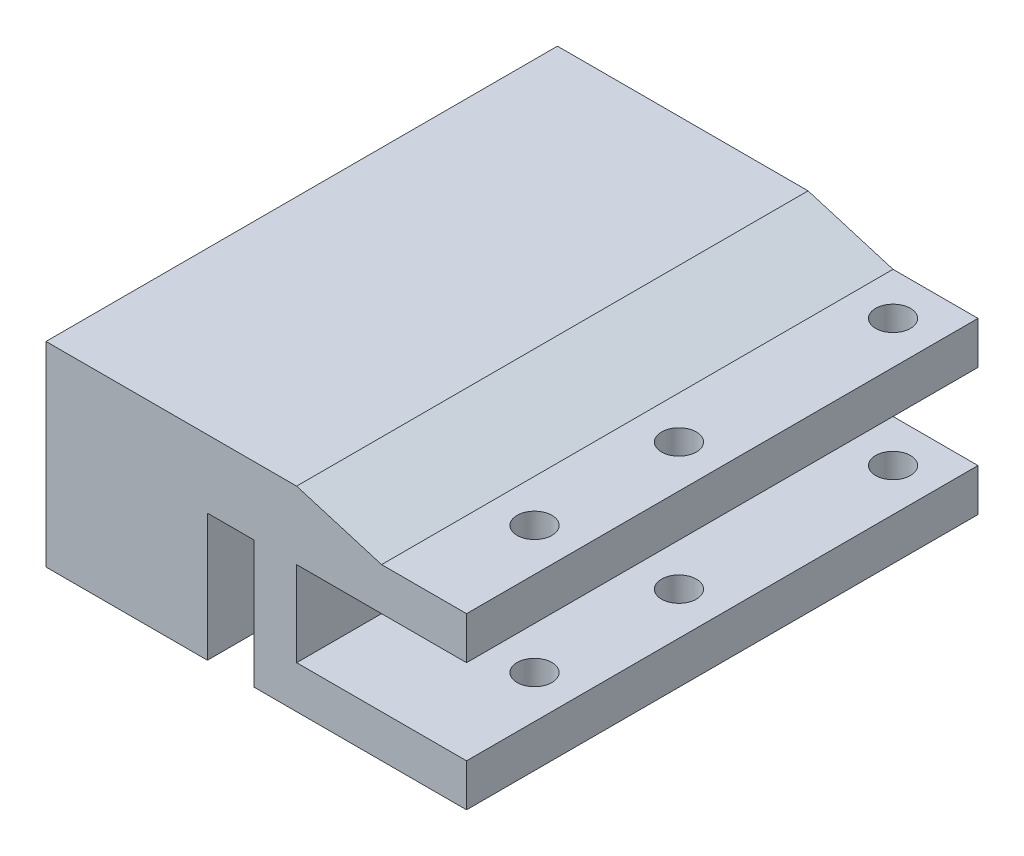
from build123d import *

# Parameters (mm, degrees)
BOSS_EXTRUDE1_DEPTH = 10
SKETCH6_W           = 20
SKETCH6_H           = 5
BOSS_EXTRUDE2_DEPTH = 20.1
SKETCH8_W           = 5.5
SKETCH8_H           = 15
CUT_EXTRUDE1_DEPTH  = 20
SKETCH9_R           = 2.05
CUT_EXTRUDE2_DEPTH  = 50
SKETCH2_R           = 2
CUT_EXTRUDE3_DEPTH  = 10
MIRROR3_OUTLINE_R   = 2
MIRROR3_DEPTH       = 10


# Read off the part's stored shape, not the designer's step: Mirror3
with BuildPart() as part:
    # Sketch1 → Boss-Extrude1 (new body)
    with BuildSketch(Plane.XY):
        Polygon((0, 0), (0, 23), (29.5, 23), (39.5, 20), (49.5, 20), (49.5, 15), (29.5, 15), (29.5, 5), (49.5, 5), (49.5, 0), align=None)
    extrude(amount=BOSS_EXTRUDE1_DEPTH)

    # Sketch6 → Boss-Extrude2 (add)
    with BuildSketch(Plane(origin=(0, 0, 0), x_dir=(-1, 0, 0), z_dir=(0, 0, -1))):
        Polygon((-29.5, 15), (-49.5, 15), (-49.5, 20), (-39.5, 20), (-29.5, 23), (0, 23), (0, 20), (-29.5, 20), align=None)
        with Locations((-39.5, 2.5)):
            Rectangle(SKETCH6_W, SKETCH6_H)
    extrude(amount=BOSS_EXTRUDE2_DEPTH)

    # Mirror2: part across face


with BuildPart() as part_1:
    add(part.part)
    add(part.part.mirror(Plane(origin=(28.245085995, 19.497542998, -20.1), x_dir=(1, 0, 0), z_dir=(0, 0, -1))))

    # Sketch8 → Cut-Extrude1 (cut)
    with BuildSketch(Plane.XY.offset(10)):
        with Locations((21.75, 7.5)):
            Rectangle(SKETCH8_W, SKETCH8_H)
    extrude(amount=-CUT_EXTRUDE1_DEPTH, mode=Mode.SUBTRACT)

    # Sketch9 → Cut-Extrude2 (cut)
    with BuildSketch(Plane.XZ):
        with Locations(Location((44.5, -3, 0), (0, 0, 270))):
            Circle(SKETCH9_R)
        with Locations(Location((44.5, -45.2, 0), (0, 0, 270))):
            Circle(SKETCH9_R)
        with Locations(Location((44.5, -20, 0), (0, 0, 270))):
            Circle(SKETCH9_R)
    extrude(amount=-CUT_EXTRUDE2_DEPTH, mode=Mode.SUBTRACT)

    # Sketch2 → Cut-Extrude3 (cut)
    with BuildSketch(Plane.ZY):
        with Locations((3.9, 5)):
            Circle(SKETCH2_R)
        with Locations((3.9, 15)):
            Circle(SKETCH2_R)
    extrude(amount=-CUT_EXTRUDE3_DEPTH, mode=Mode.SUBTRACT)

    # Mirror3 outline → Mirror3 (cut)
    with BuildSketch(Plane.YZ):
        with Locations((15, -44.1)):
            Circle(MIRROR3_OUTLINE_R)
        with Locations((5, -44.1)):
            Circle(MIRROR3_OUTLINE_R)
    extrude(amount=MIRROR3_DEPTH, mode=Mode.SUBTRACT)


solid = part_1.part
